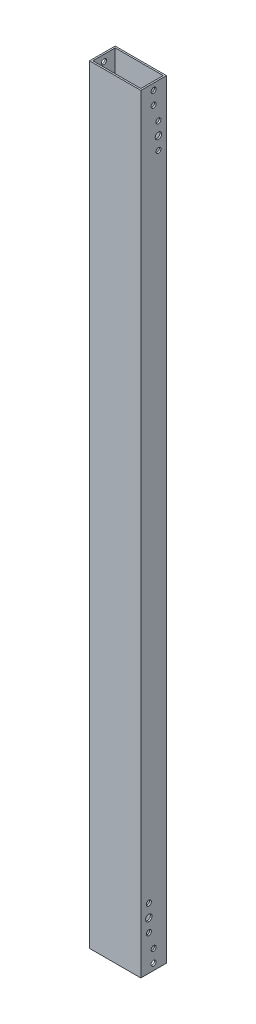
from build123d import *

# Parameters (mm, degrees)
SKETCH1_W               = 50.8
SKETCH1_H               = 762
BOSS_EXTRUDE1_DEPTH     = 12.7
SHELL1_T                = -1.5875
SKETCH3_R               = 2.4892
CUT_EXTRUDE1_DEPTH      = 383.056867495
CUT_EXTRUDE2_DEPTH      = 383.056867495
CUT_EXTRUDE2_DEPTH_BACK = 383.056867495
SKETCH4_R               = 3.175
SKETCH4_R_2             = 2.4892


with BuildPart() as part:
    # Sketch1 → Boss-Extrude1 (new, symmetric)
    with BuildSketch(Plane.XY):
        Rectangle(SKETCH1_W, SKETCH1_H)
    extrude(amount=BOSS_EXTRUDE1_DEPTH, both=True)

    # Shell1
    shell1_openings = [part.faces().sort_by_distance(p)[0] for p in [
        (0, -381, 0),
        (0, 381, 0),
    ]]
    offset(amount=SHELL1_T, openings=shell1_openings, kind=Kind.INTERSECTION)

    # Sketch3 → Cut-Extrude1 (cut, symmetric)
    with BuildSketch(Plane(origin=(0, 0, 0), x_dir=(0, 0, -1), z_dir=(1, 0, 0))):
        with Locations((0, -374.65)):
            Circle(SKETCH3_R)
        with Locations((0, -361.95)):
            Circle(SKETCH3_R)
    cut_extrude1 = extrude(amount=CUT_EXTRUDE1_DEPTH, both=True, mode=Mode.SUBTRACT)

    # Sketch4 → Cut-Extrude2 (cut, two sides: drawn at the far end of the back side and taken through both)
    with BuildSketch(Plane(origin=(0, 0, 0), x_dir=(0, 0, -1), z_dir=(1, 0, 0)).offset(-CUT_EXTRUDE2_DEPTH_BACK)):
        with Locations((4.7625, 333.375)):
            Circle(SKETCH4_R)
        with Locations((4.7625, 346.075)):
            Circle(SKETCH4_R_2)
        with Locations((4.7625, 320.675)):
            Circle(SKETCH4_R_2)
        with Locations((-4.7625, -333.375)):
            Circle(SKETCH4_R)
        with Locations((-4.7625, -320.675)):
            Circle(SKETCH4_R_2)
        with Locations((-4.7625, -346.075)):
            Circle(SKETCH4_R_2)
    extrude(amount=CUT_EXTRUDE2_DEPTH + CUT_EXTRUDE2_DEPTH_BACK, mode=Mode.SUBTRACT)

    # Mirror1: Cut-Extrude1 across plane
    add(cut_extrude1.mirror(Plane.ZX), mode=Mode.SUBTRACT)


solid = part.part
